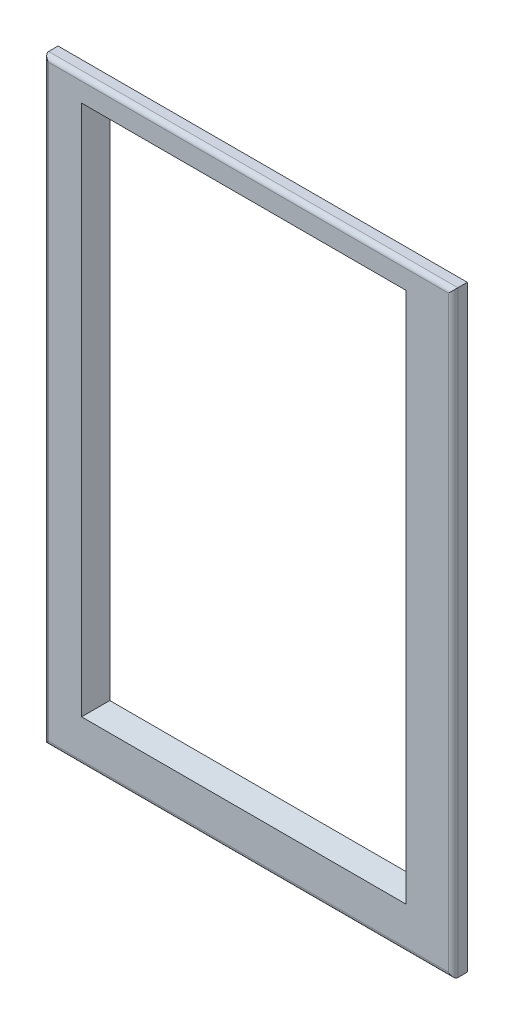
from build123d import *

# Parameters (mm, degrees)
SKETCH1_W           = 87
SKETCH1_H           = 127
SKETCH1_W_2         = 79
SKETCH1_H_2         = 119
SKETCH1_W_3         = 63
SKETCH1_H_3         = 107
BOSS_EXTRUDE1_DEPTH = 3
CHAMFER2_SIZE       = 3
FILLET1_R           = 1


with BuildPart() as part:
    # Sketch1 → Boss-Extrude1 (new body)
    # profile 1 of 2: a face of its own
    with BuildSketch(Plane.XY):
        with Locations((191.590301411, -234.498578163)):
            Rectangle(SKETCH1_W, SKETCH1_H)
        with Locations((191.590301411, -234.498578163)):
            Rectangle(SKETCH1_W_2, SKETCH1_H_2, mode=Mode.SUBTRACT)
    # profile 2 of 2: a face of its own
    with BuildSketch(Plane.XY):
        with Locations((191.590301411, -234.498578163)):
            Rectangle(SKETCH1_W_2, SKETCH1_H_2)
        with Locations((190.590301411, -232.498578163)):
            Rectangle(SKETCH1_W_3, SKETCH1_H_3, mode=Mode.SUBTRACT)
    extrude(amount=BOSS_EXTRUDE1_DEPTH)

    # Chamfer2
    chamfer2_edges = [part.edges().sort_by_distance(p)[0] for p in [
        (190.590301411, -285.998578163, 3),
        (159.090301411, -232.498578163, 3),
        (190.590301411, -178.998578163, 3),
        (222.090301411, -232.498578163, 3),
    ]]
    chamfer(chamfer2_edges, length=CHAMFER2_SIZE - 0.0001)  # a hair under: the kernel refuses the full size

    # Fillet1
    fillet1_edges = [part.edges().sort_by_distance(p)[0] for p in [
        (191.590301411, -170.998578163, 3),
        (148.090301411, -234.498578163, 3),
        (191.590301411, -297.998578163, 3),
        (235.090301411, -234.498578163, 3),
    ]]
    fillet(fillet1_edges, radius=FILLET1_R)


solid = part.part
